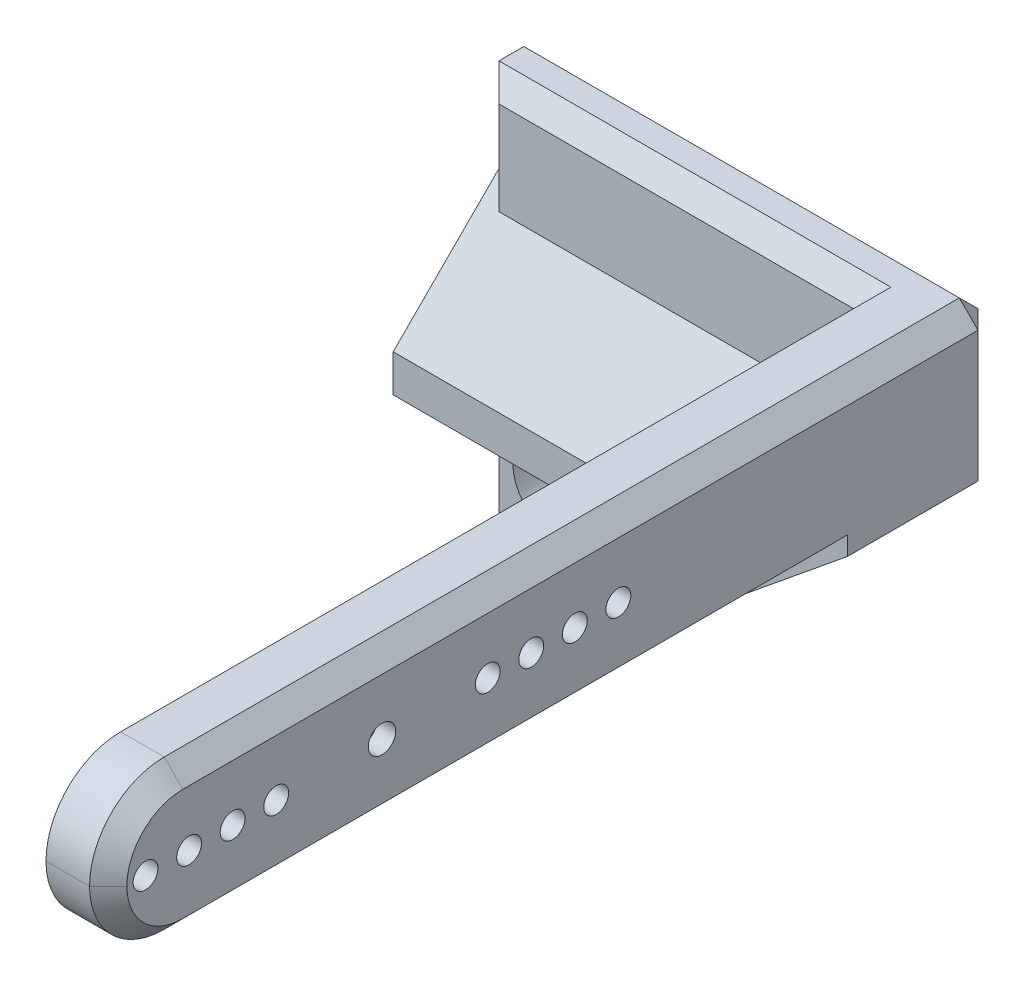
from build123d import *

# Parameters (mm, degrees)
CROQUIS1_W              = 12
CROQUIS1_H              = 12
CROQUIS1_R              = 3.375
SALIENTE_EXTRUIR1_DEPTH = 5
CROQUIS2_W              = 71.4
CROQUIS2_H              = 12
CROQUIS2_R              = 2.1
SALIENTE_EXTRUIR2_DEPTH = 5
CORTAR_EXTRUIR1_REACH   = 84.645
CROQUIS4_R              = 1
CORTAR_EXTRUIR2_START   = -5
CROQUIS5_R              = 2.1
CORTAR_EXTRUIR2_DEPTH   = 3
SALIENTE_EXTRUIR4_START = -1.5
CROQUIS6_R              = 2.1
CROQUIS6_R_2            = 1.1
SALIENTE_EXTRUIR4_DEPTH = 1.5
REDONDEO2_R             = 6
SALIENTE_EXTRUIR5_DEPTH = 5
SALIENTE_EXTRUIR6_DEPTH = 7
CHAFL_N1_SIZE           = 7
CHAFL_N2_SIZE           = 1.5


# Some blends are built 0.0001 mm under size
with BuildPart() as part:
    # Croquis1 → Saliente-Extruir1 (new body)
    # profile 1 of 2: a face of its own
    with BuildSketch(Plane.XY):
        Polygon((25.5, 20), (-6, 20), (-6, 0), (6, 0), (6, 8), (25.5, 8), align=None)
    # profile 2 of 2: a face of its own
    with BuildSketch(Plane.XY):
        with Locations((0, -6)):
            Rectangle(CROQUIS1_W, CROQUIS1_H)
        with Locations((0, -6)):
            Circle(CROQUIS1_R, mode=Mode.SUBTRACT)
    extrude(amount=SALIENTE_EXTRUIR1_DEPTH)

    # Croquis2 → Saliente-Extruir2 (add)
    with BuildSketch(Plane(origin=(25.5, 0, 0), x_dir=(0, 0, -1), z_dir=(1, 0, 0))):
        with Locations((-35.7, 14)):
            Rectangle(CROQUIS2_W, CROQUIS2_H)
        with Locations((-49.4, 14)):
            Circle(CROQUIS2_R, mode=Mode.SUBTRACT)
    extrude(amount=SALIENTE_EXTRUIR2_DEPTH)

    # Croquis4 → Cortar-Extruir1 (cut, up to next)
    with BuildSketch(Plane(origin=(30.5, 0, 0), x_dir=(0, 0, -1), z_dir=(1, 0, 0)), mode=Mode.PRIVATE) as cortar_extruir1_sk1:
        with Locations((-68.4, 14)):
            Circle(CROQUIS4_R)
    cortar_extruir1_tool1 = extrude(cortar_extruir1_sk1.sketch, amount=-CORTAR_EXTRUIR1_REACH, mode=Mode.PRIVATE) & part.part
    # Croquis4 → Cortar-Extruir1 (cut, up to next)
    with BuildSketch(Plane(origin=(30.5, 0, 0), x_dir=(0, 0, -1), z_dir=(1, 0, 0)), mode=Mode.PRIVATE) as cortar_extruir1_sk2:
        with Locations((-64.9, 14)):
            Circle(CROQUIS4_R)
    cortar_extruir1_tool2 = extrude(cortar_extruir1_sk2.sketch, amount=-CORTAR_EXTRUIR1_REACH, mode=Mode.PRIVATE) & part.part
    # Croquis4 → Cortar-Extruir1 (cut, up to next)
    with BuildSketch(Plane(origin=(30.5, 0, 0), x_dir=(0, 0, -1), z_dir=(1, 0, 0)), mode=Mode.PRIVATE) as cortar_extruir1_sk3:
        with Locations((-61.4, 14)):
            Circle(CROQUIS4_R)
    cortar_extruir1_tool3 = extrude(cortar_extruir1_sk3.sketch, amount=-CORTAR_EXTRUIR1_REACH, mode=Mode.PRIVATE) & part.part
    # Croquis4 → Cortar-Extruir1 (cut, up to next)
    with BuildSketch(Plane(origin=(30.5, 0, 0), x_dir=(0, 0, -1), z_dir=(1, 0, 0)), mode=Mode.PRIVATE) as cortar_extruir1_sk4:
        with Locations((-57.9, 14)):
            Circle(CROQUIS4_R)
    cortar_extruir1_tool4 = extrude(cortar_extruir1_sk4.sketch, amount=-CORTAR_EXTRUIR1_REACH, mode=Mode.PRIVATE) & part.part
    # Croquis4 → Cortar-Extruir1 (cut, up to next)
    with BuildSketch(Plane(origin=(30.5, 0, 0), x_dir=(0, 0, -1), z_dir=(1, 0, 0)), mode=Mode.PRIVATE) as cortar_extruir1_sk5:
        with Locations((-40.9, 14)):
            Circle(CROQUIS4_R)
    cortar_extruir1_tool5 = extrude(cortar_extruir1_sk5.sketch, amount=-CORTAR_EXTRUIR1_REACH, mode=Mode.PRIVATE) & part.part
    # Croquis4 → Cortar-Extruir1 (cut, up to next)
    with BuildSketch(Plane(origin=(30.5, 0, 0), x_dir=(0, 0, -1), z_dir=(1, 0, 0)), mode=Mode.PRIVATE) as cortar_extruir1_sk6:
        with Locations((-37.4, 14)):
            Circle(CROQUIS4_R)
    cortar_extruir1_tool6 = extrude(cortar_extruir1_sk6.sketch, amount=-CORTAR_EXTRUIR1_REACH, mode=Mode.PRIVATE) & part.part
    # Croquis4 → Cortar-Extruir1 (cut, up to next)
    with BuildSketch(Plane(origin=(30.5, 0, 0), x_dir=(0, 0, -1), z_dir=(1, 0, 0)), mode=Mode.PRIVATE) as cortar_extruir1_sk7:
        with Locations((-33.9, 14)):
            Circle(CROQUIS4_R)
    cortar_extruir1_tool7 = extrude(cortar_extruir1_sk7.sketch, amount=-CORTAR_EXTRUIR1_REACH, mode=Mode.PRIVATE) & part.part
    # Croquis4 → Cortar-Extruir1 (cut, up to next)
    with BuildSketch(Plane(origin=(30.5, 0, 0), x_dir=(0, 0, -1), z_dir=(1, 0, 0)), mode=Mode.PRIVATE) as cortar_extruir1_sk8:
        with Locations((-30.4, 14)):
            Circle(CROQUIS4_R)
    cortar_extruir1_tool8 = extrude(cortar_extruir1_sk8.sketch, amount=-CORTAR_EXTRUIR1_REACH, mode=Mode.PRIVATE) & part.part
    add(cortar_extruir1_tool1.solids().sort_by_distance((30.5, 14, 68.4))[0], mode=Mode.SUBTRACT)
    add(cortar_extruir1_tool2.solids().sort_by_distance((30.5, 14, 64.9))[0], mode=Mode.SUBTRACT)
    add(cortar_extruir1_tool3.solids().sort_by_distance((30.5, 14, 61.4))[0], mode=Mode.SUBTRACT)
    add(cortar_extruir1_tool4.solids().sort_by_distance((30.5, 14, 57.9))[0], mode=Mode.SUBTRACT)
    add(cortar_extruir1_tool5.solids().sort_by_distance((30.5, 14, 40.9))[0], mode=Mode.SUBTRACT)
    add(cortar_extruir1_tool6.solids().sort_by_distance((30.5, 14, 37.4))[0], mode=Mode.SUBTRACT)
    add(cortar_extruir1_tool7.solids().sort_by_distance((30.5, 14, 33.9))[0], mode=Mode.SUBTRACT)
    add(cortar_extruir1_tool8.solids().sort_by_distance((30.5, 14, 30.4))[0], mode=Mode.SUBTRACT)

    # Croquis5 → Cortar-Extruir2 (cut)
    with BuildSketch(Plane(origin=(30.5, 0, 0), x_dir=(0, 0, -1), z_dir=(1, 0, 0)).offset(CORTAR_EXTRUIR2_START)):
        with Locations((-57.9, 14)):
            Circle(CROQUIS5_R)
        with Locations((-64.9, 14)):
            Circle(CROQUIS5_R)
        with Locations((-40.9, 14)):
            Circle(CROQUIS5_R)
        with Locations((-33.9, 14)):
            Circle(CROQUIS5_R)
    extrude(amount=CORTAR_EXTRUIR2_DEPTH, mode=Mode.SUBTRACT)

    # Croquis6 → Saliente-Extruir4 (add)
    with BuildSketch(Plane(origin=(30.5, 0, 0), x_dir=(0, 0, -1), z_dir=(1, 0, 0)).offset(SALIENTE_EXTRUIR4_START)):
        with Locations((-49.4, 14)):
            Circle(CROQUIS6_R)
        with Locations((-49.4, 14)):
            Circle(CROQUIS6_R_2, mode=Mode.SUBTRACT)
    extrude(amount=SALIENTE_EXTRUIR4_DEPTH)

    # Redondeo2
    # the kernel refuses this fillet: 6 mm, written as the material it takes off along each edge
    with BuildSketch(Plane(origin=(10.5, 20, 71.4), x_dir=(0, 0, -1), z_dir=(1, 0, 0)), Plane(origin=(10.5, 8, 71.4), x_dir=(0, 1, 0), z_dir=(1, 0, 0))) as redondeo2_piece_1:
        with BuildLine():
            CenterArc((REDONDEO2_R, -REDONDEO2_R), REDONDEO2_R, 90, 90)
            Line((0, -REDONDEO2_R), (0, 0))
            Line((0, 0), (REDONDEO2_R, 0))
        make_face()
    extrude(amount=35, mode=Mode.SUBTRACT)

    # Croquis10 → Saliente-Extruir5 (add)
    with BuildSketch(Plane(origin=(0, 0, 0), x_dir=(-1, 0, 0), z_dir=(0, 0, -1))):
        Polygon((-6, 8), (-6, -12), (-30.5, 8), align=None)
    extrude(amount=-SALIENTE_EXTRUIR5_DEPTH)

    # Croquis11 → Saliente-Extruir6 (add)
    with BuildSketch(Plane.XY.offset(5)):
        Polygon((-6, 1), (21.925, 1), (30.5, 8), (25.5, 8), (20.6, 4), (-6, 4), align=None)
    extrude(amount=SALIENTE_EXTRUIR6_DEPTH)

    # Chaflán1
    chafl_n1_edges = [part.edges().sort_by_distance(p)[0] for p in [
        (7.3, 4, 5),
    ]]
    chamfer(chafl_n1_edges, length=CHAFL_N1_SIZE - 0.0001)  # a hair under: the kernel refuses the full size

    # Chaflán2
    chafl_n2_edges = [part.edges().sort_by_distance(p)[0] for p in [
        (12.25, 20, 0),
        (30.5, 14, 71.4),
        (30.5, 14, 71.4),
        (18.25, -2, 0),
        (13.9625, -5.5, 5),
        (30.5, 8, 38.7),
        (-6, -5.5, 5),
        (9.75, 20, 5),
        (-6, 15.49995, 5),
        (30.5, 14, 0),
        (0, -12, 5),
        (30.5, 20, 32.7),
        (0, -12, 0),
        (-6, 4, 0),
    ]]
    chamfer(chafl_n2_edges, length=CHAFL_N2_SIZE)


solid = part.part
